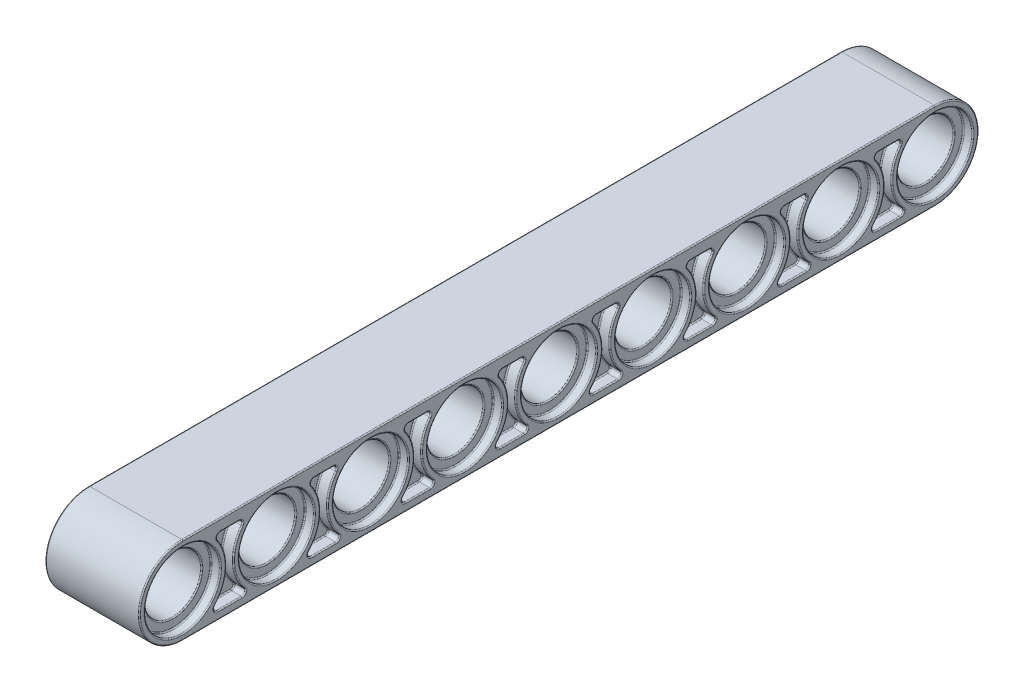
from build123d import *

# Parameters (mm, degrees)
SKETCH2_R           = 2.4
BOSS_EXTRUDE1_DEPTH = 8
SKETCH3_R           = 3.2
CUT_EXTRUDE1_DEPTH  = 0.8
CUT_EXTRUDE2_START  = -1
CUT_EXTRUDE2_DEPTH  = 1
FILLET1_R           = 0.1


with BuildPart() as part:
    # Sketch2 → Boss-Extrude1 (new body)
    with BuildSketch(Plane(origin=(0, 0, 0), x_dir=(0, 0, -1), z_dir=(1, 0, 0))):
        with BuildLine():
            Line((-40.213333333, 3.7), (23.786666667, 3.7))
            ThreePointArc((23.786666667, 3.7), (27.486666667, 0), (23.786666667, -3.7))
            Line((23.786666667, -3.7), (-40.213333333, -3.7))
            ThreePointArc((-40.213333333, -3.7), (-43.913333333, 0), (-40.213333333, 3.7))
        make_face()
        with Locations((-40.213333333, 0)):
            Circle(SKETCH2_R, mode=Mode.SUBTRACT)
        with Locations((-32.213333333, 0)):
            Circle(SKETCH2_R, mode=Mode.SUBTRACT)
        with Locations((-24.213333333, 0)):
            Circle(SKETCH2_R, mode=Mode.SUBTRACT)
        with Locations((-16.213333333, 0)):
            Circle(SKETCH2_R, mode=Mode.SUBTRACT)
        with Locations((-8.213333333, 0)):
            Circle(SKETCH2_R, mode=Mode.SUBTRACT)
        with Locations((-0.213333333, 0)):
            Circle(SKETCH2_R, mode=Mode.SUBTRACT)
        with Locations((7.786666667, 0)):
            Circle(SKETCH2_R, mode=Mode.SUBTRACT)
        with Locations((15.786666667, 0)):
            Circle(SKETCH2_R, mode=Mode.SUBTRACT)
        with Locations((23.786666667, 0)):
            Circle(SKETCH2_R, mode=Mode.SUBTRACT)
    extrude(amount=BOSS_EXTRUDE1_DEPTH)

    # Sketch3 → Cut-Extrude1 (cut)
    with BuildSketch(Plane(origin=(8, 0, 0), x_dir=(0, 0, -1), z_dir=(1, 0, 0))):
        with Locations((-40.213333333, 0)):
            Circle(SKETCH3_R)
        with Locations((-32.213333333, 0)):
            Circle(SKETCH3_R)
        with Locations((-24.213333333, 0)):
            Circle(SKETCH3_R)
        with Locations((-16.213333333, 0)):
            Circle(SKETCH3_R)
        with Locations((-8.213333333, 0)):
            Circle(SKETCH3_R)
        with Locations((-0.213333333, 0)):
            Circle(SKETCH3_R)
        with Locations((7.786666667, 0)):
            Circle(SKETCH3_R)
        with Locations((15.786666667, 0)):
            Circle(SKETCH3_R)
        with Locations((23.786666667, 0)):
            Circle(SKETCH3_R)
    cut_extrude1 = extrude(amount=-CUT_EXTRUDE1_DEPTH, mode=Mode.SUBTRACT)

    # Mirror1: Cut-Extrude1 across plane
    add(cut_extrude1.mirror(Plane(origin=(4, 0, 0), x_dir=(0, 0, 1), z_dir=(1, 0, 0))), mode=Mode.SUBTRACT)

    # Sketch4 → Cut-Extrude2 (cut)
    with BuildSketch(Plane(origin=(8, 0, 0), x_dir=(0, 0, -1), z_dir=(1, 0, 0)).offset(CUT_EXTRUDE2_START)):
        with BuildLine():
            Line((-37.013333333, 2.7), (-35.413333333, 2.7))
            ThreePointArc((-35.413333333, 2.7), (-35.145005176, 2.534164079), (-35.173333333, 2.22))
            ThreePointArc((-35.173333333, 2.22), (-35.908940845, -0.180236291), (-34.943258928, -2.4975))
            ThreePointArc((-34.943258928, -2.4975), (-34.890059168, -2.820933866), (-35.164604246, -3))
            Line((-35.164604246, -3), (-37.262062421, -3))
            ThreePointArc((-37.262062421, -3), (-37.536607499, -2.820933866), (-37.483407739, -2.4975))
            ThreePointArc((-37.483407739, -2.4975), (-36.517725822, -0.180236291), (-37.253333333, 2.22))
            ThreePointArc((-37.253333333, 2.22), (-37.281661491, 2.534164079), (-37.013333333, 2.7))
        make_face()
        with BuildLine():
            Line((-29.013333333, 2.7), (-27.413333333, 2.7))
            ThreePointArc((-27.413333333, 2.7), (-27.145005176, 2.534164079), (-27.173333333, 2.22))
            ThreePointArc((-27.173333333, 2.22), (-27.908940845, -0.180236291), (-26.943258928, -2.4975))
            ThreePointArc((-26.943258928, -2.4975), (-26.890059168, -2.820933866), (-27.164604246, -3))
            Line((-27.164604246, -3), (-29.262062421, -3))
            ThreePointArc((-29.262062421, -3), (-29.536607499, -2.820933866), (-29.483407739, -2.4975))
            ThreePointArc((-29.483407739, -2.4975), (-28.517725822, -0.180236291), (-29.253333333, 2.22))
            ThreePointArc((-29.253333333, 2.22), (-29.281661491, 2.534164079), (-29.013333333, 2.7))
        make_face()
        with BuildLine():
            Line((-21.013333333, 2.7), (-19.413333333, 2.7))
            ThreePointArc((-19.413333333, 2.7), (-19.145005176, 2.534164079), (-19.173333333, 2.22))
            ThreePointArc((-19.173333333, 2.22), (-19.908940845, -0.180236291), (-18.943258928, -2.4975))
            ThreePointArc((-18.943258928, -2.4975), (-18.890059168, -2.820933866), (-19.164604246, -3))
            Line((-19.164604246, -3), (-21.262062421, -3))
            ThreePointArc((-21.262062421, -3), (-21.536607499, -2.820933866), (-21.483407739, -2.4975))
            ThreePointArc((-21.483407739, -2.4975), (-20.517725822, -0.180236291), (-21.253333333, 2.22))
            ThreePointArc((-21.253333333, 2.22), (-21.281661491, 2.534164079), (-21.013333333, 2.7))
        make_face()
        with BuildLine():
            Line((-13.013333333, 2.7), (-11.413333333, 2.7))
            ThreePointArc((-11.413333333, 2.7), (-11.145005176, 2.534164079), (-11.173333333, 2.22))
            ThreePointArc((-11.173333333, 2.22), (-11.908940845, -0.180236291), (-10.943258928, -2.4975))
            ThreePointArc((-10.943258928, -2.4975), (-10.890059168, -2.820933866), (-11.164604246, -3))
            Line((-11.164604246, -3), (-13.262062421, -3))
            ThreePointArc((-13.262062421, -3), (-13.536607499, -2.820933866), (-13.483407739, -2.4975))
            ThreePointArc((-13.483407739, -2.4975), (-12.517725822, -0.180236291), (-13.253333333, 2.22))
            ThreePointArc((-13.253333333, 2.22), (-13.281661491, 2.534164079), (-13.013333333, 2.7))
        make_face()
        with BuildLine():
            Line((-5.013333333, 2.7), (-3.413333333, 2.7))
            ThreePointArc((-3.413333333, 2.7), (-3.145005176, 2.534164079), (-3.173333333, 2.22))
            ThreePointArc((-3.173333333, 2.22), (-3.908940845, -0.180236291), (-2.943258928, -2.4975))
            ThreePointArc((-2.943258928, -2.4975), (-2.890059168, -2.820933866), (-3.164604246, -3))
            Line((-3.164604246, -3), (-5.262062421, -3))
            ThreePointArc((-5.262062421, -3), (-5.536607499, -2.820933866), (-5.483407739, -2.4975))
            ThreePointArc((-5.483407739, -2.4975), (-4.517725822, -0.180236291), (-5.253333333, 2.22))
            ThreePointArc((-5.253333333, 2.22), (-5.281661491, 2.534164079), (-5.013333333, 2.7))
        make_face()
        with BuildLine():
            Line((2.986666667, 2.7), (4.586666667, 2.7))
            ThreePointArc((4.586666667, 2.7), (4.854994824, 2.534164079), (4.826666667, 2.22))
            ThreePointArc((4.826666667, 2.22), (4.091059155, -0.180236291), (5.056741072, -2.4975))
            ThreePointArc((5.056741072, -2.4975), (5.109940832, -2.820933866), (4.835395754, -3))
            Line((4.835395754, -3), (2.737937579, -3))
            ThreePointArc((2.737937579, -3), (2.463392501, -2.820933866), (2.516592261, -2.4975))
            ThreePointArc((2.516592261, -2.4975), (3.482274178, -0.180236291), (2.746666667, 2.22))
            ThreePointArc((2.746666667, 2.22), (2.718338509, 2.534164079), (2.986666667, 2.7))
        make_face()
        with BuildLine():
            Line((10.986666667, 2.7), (12.586666667, 2.7))
            ThreePointArc((12.586666667, 2.7), (12.854994824, 2.534164079), (12.826666667, 2.22))
            ThreePointArc((12.826666667, 2.22), (12.091059155, -0.180236291), (13.056741072, -2.4975))
            ThreePointArc((13.056741072, -2.4975), (13.109940832, -2.820933866), (12.835395754, -3))
            Line((12.835395754, -3), (10.737937579, -3))
            ThreePointArc((10.737937579, -3), (10.463392501, -2.820933866), (10.516592261, -2.4975))
            ThreePointArc((10.516592261, -2.4975), (11.482274178, -0.180236291), (10.746666667, 2.22))
            ThreePointArc((10.746666667, 2.22), (10.718338509, 2.534164079), (10.986666667, 2.7))
        make_face()
        with BuildLine():
            Line((18.986666667, 2.7), (20.586666667, 2.7))
            ThreePointArc((20.586666667, 2.7), (20.854994824, 2.534164079), (20.826666667, 2.22))
            ThreePointArc((20.826666667, 2.22), (20.091059155, -0.180236291), (21.056741072, -2.4975))
            ThreePointArc((21.056741072, -2.4975), (21.109940832, -2.820933866), (20.835395754, -3))
            Line((20.835395754, -3), (18.737937579, -3))
            ThreePointArc((18.737937579, -3), (18.463392501, -2.820933866), (18.516592261, -2.4975))
            ThreePointArc((18.516592261, -2.4975), (19.482274178, -0.180236291), (18.746666667, 2.22))
            ThreePointArc((18.746666667, 2.22), (18.718338509, 2.534164079), (18.986666667, 2.7))
        make_face()
    cut_extrude2 = extrude(amount=CUT_EXTRUDE2_DEPTH, mode=Mode.SUBTRACT)

    # Mirror2: Cut-Extrude2 across plane
    add(cut_extrude2.mirror(Plane(origin=(4, 0, 0), x_dir=(0, 0, 1), z_dir=(1, 0, 0))), mode=Mode.SUBTRACT)

    # Fillet1
    fillet1_edges = [part.edges().sort_by_distance(p)[0] for p in [
        (7.2, 0, -20.586666667),
        (7, -0.180236291, -19.482274178),
        (7, 2.534164079, -18.718338509),
        (7, 2.7, -19.786666667),
        (7, 2.534164079, -20.854994824),
        (7, -0.180236291, -20.091059155),
        (7, -2.820933866, -21.109940832),
        (7, -3, -19.786666667),
        (7, -2.820933866, -18.463392501),
        (7.2, 0, -12.586666667),
        (7, -0.180236291, -11.482274178),
        (7, 2.534164079, -10.718338509),
        (7, 2.7, -11.786666667),
        (7, 2.534164079, -12.854994824),
        (7, -0.180236291, -12.091059155),
        (7, -2.820933866, -13.109940832),
        (7, -3, -11.786666667),
        (7, -2.820933866, -10.463392501),
        (7.2, 0, -4.586666667),
        (7, -0.180236291, -3.482274178),
        (7, 2.534164079, -2.718338509),
        (7, 2.7, -3.786666667),
        (7, 2.534164079, -4.854994824),
        (7, -0.180236291, -4.091059155),
        (7, -2.820933866, -5.109940832),
        (7, -3, -3.786666667),
        (7, -2.820933866, -2.463392501),
        (7.2, 0, 3.413333333),
        (7, -0.180236291, 4.517725822),
        (7, 2.534164079, 5.281661491),
        (7, 2.7, 4.213333333),
        (7, 2.534164079, 3.145005176),
        (7, -0.180236291, 3.908940845),
        (7, -2.820933866, 2.890059168),
        (7, -3, 4.213333333),
        (7, -2.820933866, 5.536607499),
        (7.2, 0, 11.413333333),
        (7, -0.180236291, 12.517725822),
        (7, 2.534164079, 13.281661491),
        (7, 2.7, 12.213333333),
        (7, 2.534164079, 11.145005176),
        (7, -0.180236291, 11.908940845),
        (7, -2.820933866, 10.890059168),
        (7, -3, 12.213333333),
        (7, -2.820933866, 13.536607499),
        (7.2, 0, 19.413333333),
        (7, -0.180236291, 20.517725822),
        (7, 2.534164079, 21.281661491),
        (7, 2.7, 20.213333333),
        (7, 2.534164079, 19.145005176),
        (7, -0.180236291, 19.908940845),
        (7, -2.820933866, 18.890059168),
        (7, -3, 20.213333333),
        (7, -2.820933866, 21.536607499),
        (7.2, 0, 27.413333333),
        (7.2, 0, 35.413333333),
        (7, -0.180236291, 28.517725822),
        (7, 2.534164079, 29.281661491),
        (7, 2.7, 28.213333333),
        (7, 2.534164079, 27.145005176),
        (7, -0.180236291, 27.908940845),
        (7, -2.820933866, 26.890059168),
        (7, -3, 28.213333333),
        (7, -2.820933866, 29.536607499),
        (7, -0.180236291, 36.517725822),
        (7, 2.534164079, 37.281661491),
        (7, 2.7, 36.213333333),
        (7, 2.534164079, 35.145005176),
        (7, -0.180236291, 35.908940845),
        (7, -2.820933866, 34.890059168),
        (7, -3, 36.213333333),
        (7, -2.820933866, 37.536607499),
        (7.2, 0, 43.413333333),
        (7.2, 0, 42.613333333),
        (0.8, 0, 43.413333333),
        (0.8, 0, 42.613333333),
        (1, -3, 36.213333333),
        (1, -2.820933866, 34.890059168),
        (1, -0.180236291, 35.908940845),
        (1, 2.534164079, 35.145005176),
        (1, 2.7, 36.213333333),
        (1, 2.534164079, 37.281661491),
        (1, -0.180236291, 36.517725822),
        (1, -2.820933866, 37.536607499),
        (0.8, 0, 26.613333333),
        (7.2, 0, 26.613333333),
        (7.2, 0, 34.613333333),
        (0.8, 0, 35.413333333),
        (0.8, 0, 34.613333333),
        (1, -3, 28.213333333),
        (1, -2.820933866, 26.890059168),
        (1, -0.180236291, 27.908940845),
        (1, 2.534164079, 27.145005176),
        (1, 2.7, 28.213333333),
        (1, 2.534164079, 29.281661491),
        (1, -0.180236291, 28.517725822),
        (1, -2.820933866, 29.536607499),
        (0.8, 0, 27.413333333),
        (1, -3, 20.213333333),
        (1, -2.820933866, 18.890059168),
        (1, -0.180236291, 19.908940845),
        (1, 2.534164079, 19.145005176),
        (1, 2.7, 20.213333333),
        (1, 2.534164079, 21.281661491),
        (1, -0.180236291, 20.517725822),
        (1, -2.820933866, 21.536607499),
        (7.2, 0, 18.613333333),
        (0.8, 0, 19.413333333),
        (0.8, 0, 18.613333333),
        (1, -3, 12.213333333),
        (1, -2.820933866, 10.890059168),
        (1, -0.180236291, 11.908940845),
        (1, 2.534164079, 11.145005176),
        (1, 2.7, 12.213333333),
        (1, 2.534164079, 13.281661491),
        (1, -0.180236291, 12.517725822),
        (1, -2.820933866, 13.536607499),
        (0.8, 0, 11.413333333),
        (0.8, 0, 10.613333333),
        (7.2, 0, 10.613333333),
        (1, -3, 4.213333333),
        (1, -2.820933866, 2.890059168),
        (1, -0.180236291, 3.908940845),
        (1, 2.534164079, 3.145005176),
        (1, 2.7, 4.213333333),
        (1, 2.534164079, 5.281661491),
        (1, -0.180236291, 4.517725822),
        (1, -2.820933866, 5.536607499),
        (7.2, 0, 2.613333333),
        (0.8, 0, 3.413333333),
        (0.8, 0, 2.613333333),
        (1, -3, -3.786666667),
        (1, -2.820933866, -5.109940832),
        (1, -0.180236291, -4.091059155),
        (1, 2.534164079, -4.854994824),
        (1, 2.7, -3.786666667),
        (1, 2.534164079, -2.718338509),
        (1, -0.180236291, -3.482274178),
        (1, -2.820933866, -2.463392501),
        (7.2, 0, -5.386666667),
        (0.8, 0, -4.586666667),
        (0.8, 0, -5.386666667),
        (1, -3, -11.786666667),
        (1, -2.820933866, -13.109940832),
        (1, -0.180236291, -12.091059155),
        (1, 2.534164079, -12.854994824),
        (1, 2.7, -11.786666667),
        (1, 2.534164079, -10.718338509),
        (1, -0.180236291, -11.482274178),
        (1, -2.820933866, -10.463392501),
        (7.2, 0, -13.386666667),
        (0.8, 0, -12.586666667),
        (0.8, 0, -13.386666667),
        (1, -3, -19.786666667),
        (1, -2.820933866, -21.109940832),
        (1, -0.180236291, -20.091059155),
        (1, 2.534164079, -20.854994824),
        (1, 2.7, -19.786666667),
        (1, 2.534164079, -18.718338509),
        (1, -0.180236291, -19.482274178),
        (1, -2.820933866, -18.463392501),
        (0.8, 0, -20.586666667),
        (0.8, 0, -21.386666667),
        (7.2, 0, -21.386666667),
        (0, -3.7, 8.213333333),
        (0, 0, -27.486666667),
        (0, -0.180236291, -11.482274178),
        (0, 2.534164079, -10.718338509),
        (0, 2.7, -11.786666667),
        (0, 2.534164079, -12.854994824),
        (0, -0.180236291, -12.091059155),
        (0, -2.820933866, -13.109940832),
        (0, -3, -11.786666667),
        (0, -2.820933866, -10.463392501),
        (0, -0.180236291, 4.517725822),
        (0, 2.534164079, 5.281661491),
        (0, 2.7, 4.213333333),
        (0, 2.534164079, 3.145005176),
        (0, -0.180236291, 3.908940845),
        (0, -2.820933866, 2.890059168),
        (0, -3, 4.213333333),
        (0, -2.820933866, 5.536607499),
        (0, -0.180236291, 20.517725822),
        (0, 2.534164079, 21.281661491),
        (0, 2.7, 20.213333333),
        (0, 2.534164079, 19.145005176),
        (0, -0.180236291, 19.908940845),
        (0, -2.820933866, 18.890059168),
        (0, -3, 20.213333333),
        (0, -2.820933866, 21.536607499),
        (0, -0.180236291, 36.517725822),
        (0, 2.534164079, 37.281661491),
        (0, 2.7, 36.213333333),
        (0, 2.534164079, 35.145005176),
        (0, -0.180236291, 35.908940845),
        (0, -2.820933866, 34.890059168),
        (0, -3, 36.213333333),
        (0, -2.820933866, 37.536607499),
        (0, 0, -12.586666667),
        (0, 0, 3.413333333),
        (0, 0, 19.413333333),
        (0, 0, 35.413333333),
        (0, 0, 43.413333333),
        (0, 0, 27.413333333),
        (0, 0, 11.413333333),
        (0, 0, -4.586666667),
        (0, 0, -20.586666667),
        (0, -0.180236291, 28.517725822),
        (0, 2.534164079, 29.281661491),
        (0, 2.7, 28.213333333),
        (0, 2.534164079, 27.145005176),
        (0, -0.180236291, 27.908940845),
        (0, -2.820933866, 26.890059168),
        (0, -3, 28.213333333),
        (0, -2.820933866, 29.536607499),
        (0, -0.180236291, 12.517725822),
        (0, 2.534164079, 13.281661491),
        (0, 2.7, 12.213333333),
        (0, 2.534164079, 11.145005176),
        (0, -0.180236291, 11.908940845),
        (0, -2.820933866, 10.890059168),
        (0, -3, 12.213333333),
        (0, -2.820933866, 13.536607499),
        (0, -0.180236291, -3.482274178),
        (0, 2.534164079, -2.718338509),
        (0, 2.7, -3.786666667),
        (0, 2.534164079, -4.854994824),
        (0, -0.180236291, -4.091059155),
        (0, -2.820933866, -5.109940832),
        (0, -3, -3.786666667),
        (0, -2.820933866, -2.463392501),
        (0, -0.180236291, -19.482274178),
        (0, 2.534164079, -18.718338509),
        (0, 2.7, -19.786666667),
        (0, 2.534164079, -20.854994824),
        (0, -0.180236291, -20.091059155),
        (0, -2.820933866, -21.109940832),
        (0, -3, -19.786666667),
        (0, -2.820933866, -18.463392501),
        (0, 3.7, 8.213333333),
        (0, 0, 43.913333333),
        (8, 0, 43.413333333),
        (8, 0, 35.413333333),
        (8, 0, 27.413333333),
        (8, 0, 19.413333333),
        (8, 0, 11.413333333),
        (8, 0, 3.413333333),
        (8, 0, -4.586666667),
        (8, 0, -12.586666667),
        (8, 0, -20.586666667),
        (8, -3, 36.213333333),
        (8, -2.820933866, 34.890059168),
        (8, -0.180236291, 35.908940845),
        (8, 2.534164079, 35.145005176),
        (8, 2.7, 36.213333333),
        (8, 2.534164079, 37.281661491),
        (8, -0.180236291, 36.517725822),
        (8, -2.820933866, 37.536607499),
        (8, -3, 28.213333333),
        (8, -2.820933866, 26.890059168),
        (8, -0.180236291, 27.908940845),
        (8, 2.534164079, 27.145005176),
        (8, 2.7, 28.213333333),
        (8, 2.534164079, 29.281661491),
        (8, -0.180236291, 28.517725822),
        (8, -2.820933866, 29.536607499),
        (8, -3, 20.213333333),
        (8, -2.820933866, 18.890059168),
        (8, -0.180236291, 19.908940845),
        (8, 2.534164079, 19.145005176),
        (8, 2.7, 20.213333333),
        (8, 2.534164079, 21.281661491),
        (8, -0.180236291, 20.517725822),
        (8, -2.820933866, 21.536607499),
        (8, -3, 12.213333333),
        (8, -2.820933866, 10.890059168),
        (8, -0.180236291, 11.908940845),
        (8, 2.534164079, 11.145005176),
        (8, 2.7, 12.213333333),
        (8, 2.534164079, 13.281661491),
        (8, -0.180236291, 12.517725822),
        (8, -2.820933866, 13.536607499),
        (8, -3, 4.213333333),
        (8, -2.820933866, 2.890059168),
        (8, -0.180236291, 3.908940845),
        (8, 2.534164079, 3.145005176),
        (8, 2.7, 4.213333333),
        (8, 2.534164079, 5.281661491),
        (8, -0.180236291, 4.517725822),
        (8, -2.820933866, 5.536607499),
        (8, -3, -3.786666667),
        (8, -2.820933866, -5.109940832),
        (8, -0.180236291, -4.091059155),
        (8, 2.534164079, -4.854994824),
        (8, 2.7, -3.786666667),
        (8, 2.534164079, -2.718338509),
        (8, -0.180236291, -3.482274178),
        (8, -2.820933866, -2.463392501),
        (8, -3, -11.786666667),
        (8, -2.820933866, -13.109940832),
        (8, -0.180236291, -12.091059155),
        (8, 2.534164079, -12.854994824),
        (8, 2.7, -11.786666667),
        (8, 2.534164079, -10.718338509),
        (8, -0.180236291, -11.482274178),
        (8, -2.820933866, -10.463392501),
        (8, -3, -19.786666667),
        (8, -2.820933866, -21.109940832),
        (8, -0.180236291, -20.091059155),
        (8, 2.534164079, -20.854994824),
        (8, 2.7, -19.786666667),
        (8, 2.534164079, -18.718338509),
        (8, -0.180236291, -19.482274178),
        (8, -2.820933866, -18.463392501),
        (8, -3.7, 8.213333333),
        (8, 0, 43.913333333),
        (8, 3.7, 8.213333333),
        (8, 0, -27.486666667),
    ]]
    fillet(fillet1_edges, radius=FILLET1_R)


solid = part.part
